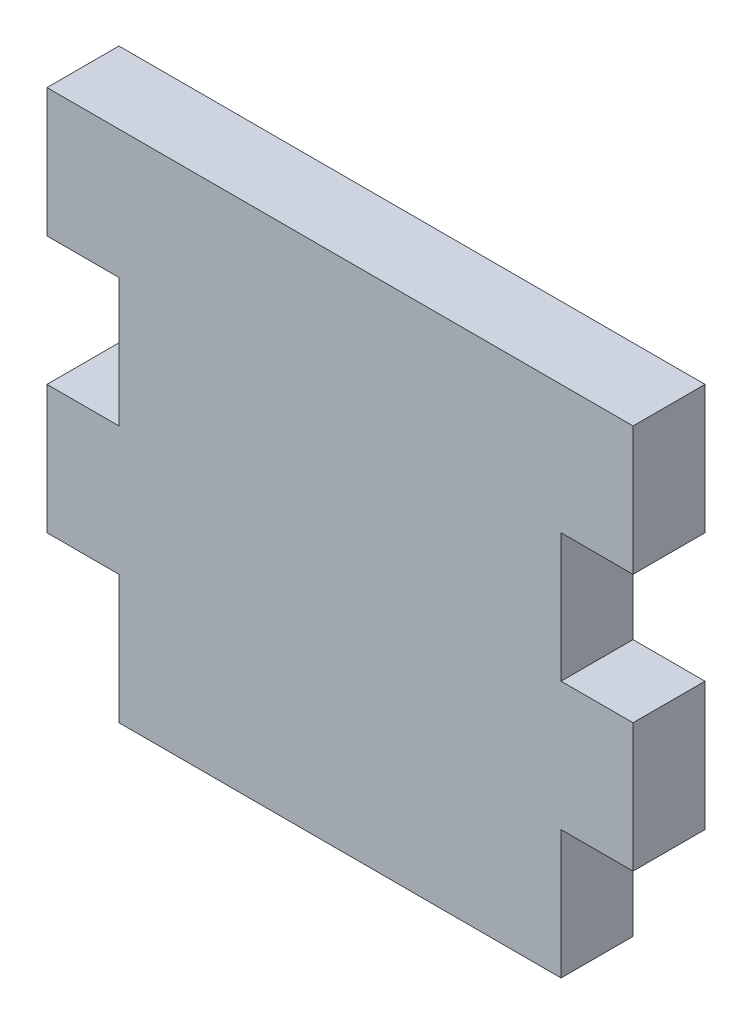
from build123d import *

# Parameters (mm, degrees)
SKETCH1_W           = 43.434
SKETCH1_H           = 38.1
BOSS_EXTRUDE1_DEPTH = 5.334
SKETCH2_W           = 5.334
SKETCH2_H           = 9.525
CUT_EXTRUDE1_DEPTH  = 92.449120695


with BuildPart() as part:
    # Sketch1 → Boss-Extrude1 (new body)
    with BuildSketch(Plane.XY):
        with Locations((-66.368249325, -4.939142782)):
            Rectangle(SKETCH1_W, SKETCH1_H)
    extrude(amount=BOSS_EXTRUDE1_DEPTH)

    # Sketch2 → Cut-Extrude1 (cut, through all)
    with BuildSketch(Plane.XY.offset(5.334)):
        with Locations((-85.418249325, -19.226642782)):
            Rectangle(SKETCH2_W, SKETCH2_H)
        with Locations((-85.418249325, -0.176642782)):
            Rectangle(SKETCH2_W, SKETCH2_H)
        with Locations((-47.318249325, -0.176642782)):
            Rectangle(SKETCH2_W, SKETCH2_H)
        with Locations((-47.318249325, -19.226642782)):
            Rectangle(SKETCH2_W, SKETCH2_H)
    extrude(amount=-CUT_EXTRUDE1_DEPTH, mode=Mode.SUBTRACT)


solid = part.part
